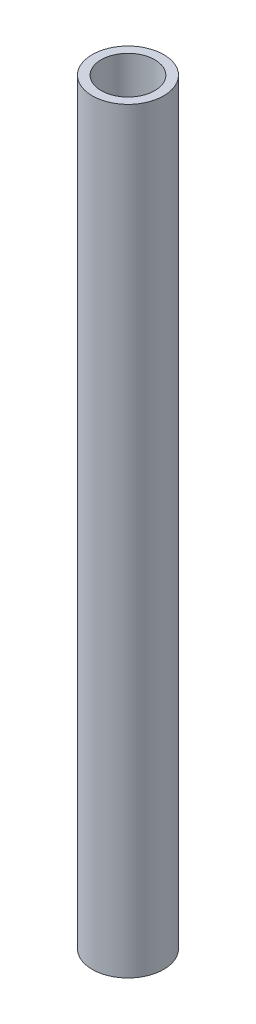
from build123d import *

# Parameters (mm, degrees)
SKETCH1_R           = 12
BOSS_EXTRUDE1_DEPTH = 254
SKETCH2_R           = 9
CUT_EXTRUDE1_DEPTH  = 254


with BuildPart() as part:
    # Sketch1 → Boss-Extrude1 (new body)
    with BuildSketch(Plane(origin=(0, 0, 0), x_dir=(1, 0, 0), z_dir=(0, 1, 0))):
        Circle(SKETCH1_R)
    extrude(amount=BOSS_EXTRUDE1_DEPTH)

    # Sketch2 → Cut-Extrude1 (cut)
    with BuildSketch(Plane(origin=(0, 254, 0), x_dir=(1, 0, 0), z_dir=(0, 1, 0))):
        Circle(SKETCH2_R)
    extrude(amount=-CUT_EXTRUDE1_DEPTH, mode=Mode.SUBTRACT)


solid = part.part
